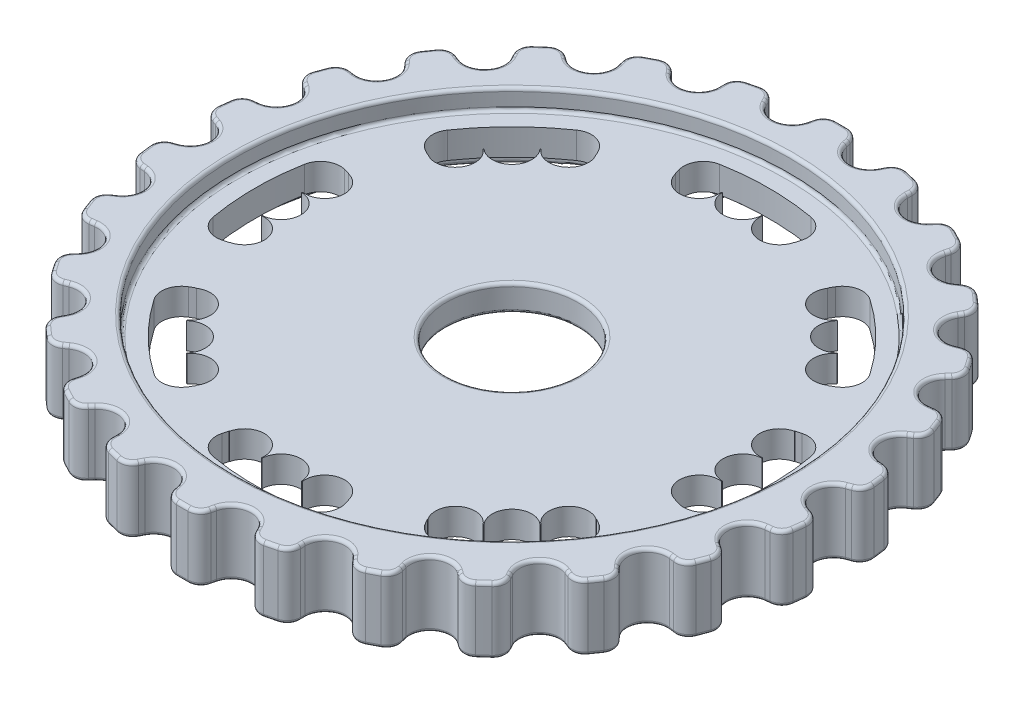
from build123d import *

# Parameters (mm, degrees)
SKETCH_1_W                          = 50
SKETCH_1_H                          = 10
CUT_REVOLVE_START                   = -5
CUT_REVOLVE_1_DEPTH                 = 10
SKETCH_5_W                          = 10
SKETCH_5_H                          = 10
FILLET_1_R                          = 2
FILLET_2_R                          = 3
PATTERN_CIRCULAR_1_COUNT            = 26
FILLET_1_OF_PATTERN_CIRCULAR_1_R    = 2
FILLET_2_OF_PATTERN_CIRCULAR_1_R    = 3
CUT_REVOLVE_7_DEPTH                 = 10
SKETCH_16_W                         = 3
SKETCH_16_H                         = 10
PATTERN_CIRCULAR_2_COUNT            = 2
PATTERN_CIRCULAR_2_ANGLE            = 10
PATTERN_CIRCULAR_3_COUNT            = 2
PATTERN_CIRCULAR_3_ANGLE            = 10
FILLET_3_R                          = 3
PATTERN_CIRCULAR_4_COUNT            = 8
PATTERN_CIRCULAR_4_COPY_1_SKETCH_W  = 3
PATTERN_CIRCULAR_4_COPY_1_SKETCH_H  = 10
PATTERN_CIRCULAR_4_COPY_2_SKETCH_W  = 3
PATTERN_CIRCULAR_4_COPY_2_SKETCH_H  = 10
PATTERN_CIRCULAR_4_COPY_3_SKETCH_W  = 3
PATTERN_CIRCULAR_4_COPY_3_SKETCH_H  = 10
PATTERN_CIRCULAR_4_COPY_4_SKETCH_W  = 3
PATTERN_CIRCULAR_4_COPY_4_SKETCH_H  = 10
PATTERN_CIRCULAR_4_COPY_5_SKETCH_W  = 3
PATTERN_CIRCULAR_4_COPY_5_SKETCH_H  = 10
PATTERN_CIRCULAR_4_COPY_6_SKETCH_W  = 3
PATTERN_CIRCULAR_4_COPY_6_SKETCH_H  = 10
PATTERN_CIRCULAR_4_COPY_7_SKETCH_W  = 3
PATTERN_CIRCULAR_4_COPY_7_SKETCH_H  = 10
PATTERN_CIRCULAR_4_COPY_8_SKETCH_W  = 3
PATTERN_CIRCULAR_4_COPY_8_SKETCH_H  = 10
PATTERN_CIRCULAR_4_COPY_9_SKETCH_W  = 3
PATTERN_CIRCULAR_4_COPY_9_SKETCH_H  = 10
PATTERN_CIRCULAR_4_COPY_10_SKETCH_W = 3
PATTERN_CIRCULAR_4_COPY_10_SKETCH_H = 10
PATTERN_CIRCULAR_4_COPY_11_SKETCH_W = 3
PATTERN_CIRCULAR_4_COPY_11_SKETCH_H = 10
PATTERN_CIRCULAR_4_COPY_12_SKETCH_W = 3
PATTERN_CIRCULAR_4_COPY_12_SKETCH_H = 10
PATTERN_CIRCULAR_4_COPY_13_SKETCH_W = 3
PATTERN_CIRCULAR_4_COPY_13_SKETCH_H = 10
PATTERN_CIRCULAR_4_COPY_14_SKETCH_W = 3
PATTERN_CIRCULAR_4_COPY_14_SKETCH_H = 10
FILLET_3_OF_PATTERN_CIRCULAR_4_R    = 3
FILLET_4_R                          = 0.5
SKETCH_17_W                         = 42
SKETCH_17_H                         = 4.5
FILLET_5_R                          = 0.5


# Read off the part's stored shape, not the designer's step: Вырез-Повернуть1, Вырез-Повернуть7
with BuildPart() as part:
    # Эскиз1 → Повернуть1 (revolve)
    with BuildSketch(Plane.XY, mode=Mode.PRIVATE) as revolve_1_sk:
        with Locations((25, 0)):
            Rectangle(SKETCH_1_W, SKETCH_1_H)
    revolve(revolve_1_sk.sketch.rotate(Axis((0, -5, 0), (0, 1, 0)), 90), axis=Axis((0, -5, 0), (0, 1, 0)))

    # Вырез-Повернуть1 outline → Вырез-Повернуть1 (cut)
    with BuildSketch(Plane(origin=(0, 0, 0), x_dir=(1, 0, 0), z_dir=(0, 1, 0)).offset(CUT_REVOLVE_START)):
        with BuildLine():
            Line((-49.870760692, -3.592663081), (-40, 0))
            Line((-40, 0), (-49.870760692, 3.592663081))
            ThreePointArc((-49.870760692, 3.592663081), (-50, 0), (-49.870760692, -3.592663081))
        make_face()
    cut_revolve_1 = extrude(amount=CUT_REVOLVE_1_DEPTH, mode=Mode.SUBTRACT)

    # Эскиз5 → Вырез-Повернуть2 (revolve, cut)
    with BuildSketch(Plane(origin=(0, 0, 0), x_dir=(0, 0, -1), z_dir=(1, 0, 0)), mode=Mode.PRIVATE) as cut_revolve_2_sk:
        with Locations((-5, 0)):
            Rectangle(SKETCH_5_W, SKETCH_5_H)
    revolve(cut_revolve_2_sk.sketch.rotate(Axis((0, -5, 0), (0, 1, 0)), 180), axis=Axis((0, -5, 0), (0, 1, 0)), mode=Mode.SUBTRACT)

    # Скругление1
    fillet_1_edges = [part.edges().sort_by_distance(p)[0] for p in [
        (-49.870760692, 0, -3.592663081),
        (-49.870760692, 0, 3.592663081),
    ]]
    fillet(fillet_1_edges, radius=FILLET_1_R)

    # Скругление2
    fillet_2_edges = [part.edges().sort_by_distance(p)[0] for p in [
        (-40, 0, 0),
    ]]
    fillet(fillet_2_edges, radius=FILLET_2_R)

    # Круговой массив1: Вырез-Повернуть1 ×26 about axis
    pattern_circular_1_axis = Axis((0, 0, 0), (0, 1, 0))
    for i in range(1, PATTERN_CIRCULAR_1_COUNT):
        add(cut_revolve_1.rotate(pattern_circular_1_axis, i * 360 / PATTERN_CIRCULAR_1_COUNT), mode=Mode.SUBTRACT)

    # Скругление1 of Круговой массив1
    fillet_1_of_pattern_circular_1_edges = [part.edges().sort_by_distance(p)[0] for p in [
        (-49.281387575, 0, 8.446587402),
        (-47.561826471, 0, 15.423121045),
        (-45.827959342, 0, 19.994952928),
        (-42.488771776, 0, 26.357243274),
        (-39.71117669, 0, 30.381284468),
        (-34.946424105, 0, 35.759578329),
        (-31.286524793, 0, 39.001966186),
        (-25.373117291, 0, 43.083696673),
        (-21.043613797, 0, 45.355995396),
        (-14.325217127, 0, 47.903947168),
        (-9.577724458, 0, 49.074099016),
        (-2.444787413, 0, 49.940194378),
        (2.444787413, 0, 49.940194378),
        (9.577724458, 0, 49.074099016),
        (14.325217127, 0, 47.903947168),
        (21.043613797, 0, 45.355995396),
        (25.373117291, 0, 43.083696673),
        (31.286524793, 0, 39.001966186),
        (34.946424105, 0, 35.759578329),
        (39.71117669, 0, 30.381284468),
        (42.488771776, 0, 26.357243274),
        (45.827959342, 0, 19.994952928),
        (47.561826471, 0, 15.423121045),
        (49.281387575, 0, 8.446587402),
        (49.870760692, 0, 3.592663081),
        (49.870760692, 0, -3.592663081),
        (49.281387575, 0, -8.446587402),
        (47.561826471, 0, -15.423121045),
        (45.827959342, 0, -19.994952928),
        (42.488771776, 0, -26.357243274),
        (39.71117669, 0, -30.381284468),
        (34.946424105, 0, -35.759578329),
        (31.286524793, 0, -39.001966186),
        (25.373117291, 0, -43.083696673),
        (21.043613797, 0, -45.355995396),
        (14.325217127, 0, -47.903947168),
        (9.577724458, 0, -49.074099016),
        (2.444787413, 0, -49.940194378),
        (-2.444787413, 0, -49.940194378),
        (-9.577724458, 0, -49.074099016),
        (-14.325217127, 0, -47.903947168),
        (-21.043613797, 0, -45.355995396),
        (-25.373117291, 0, -43.083696673),
        (-31.286524793, 0, -39.001966186),
        (-34.946424105, 0, -35.759578329),
        (-39.71117669, 0, -30.381284468),
        (-42.488771776, 0, -26.357243274),
        (-45.827959342, 0, -19.994952928),
        (-47.561826471, 0, -15.423121045),
        (-49.281387575, 0, -8.446587402),
    ]]
    fillet(fillet_1_of_pattern_circular_1_edges, radius=FILLET_1_OF_PATTERN_CIRCULAR_1_R)

    # Скругление2 of Круговой массив1
    fillet_2_of_pattern_circular_1_edges = [part.edges().sort_by_distance(p)[0] for p in [
        (-38.837672697, 0, 9.572626572),
        (-35.418241026, 0, 18.588926882),
        (-29.940429927, 0, 26.52490633),
        (-22.722589869, 0, 32.919354636),
        (-14.184195482, 0, 37.400649707),
        (-4.82146721, 0, 39.708354964),
        (4.82146721, 0, 39.708354964),
        (14.184195482, 0, 37.400649707),
        (22.722589869, 0, 32.919354636),
        (29.940429927, 0, 26.52490633),
        (35.418241026, 0, 18.588926882),
        (38.837672697, 0, 9.572626572),
        (40, 0, 0),
        (38.837672697, 0, -9.572626572),
        (35.418241026, 0, -18.588926882),
        (29.940429927, 0, -26.52490633),
        (22.722589869, 0, -32.919354636),
        (14.184195482, 0, -37.400649707),
        (4.82146721, 0, -39.708354964),
        (-4.82146721, 0, -39.708354964),
        (-14.184195482, 0, -37.400649707),
        (-22.722589869, 0, -32.919354636),
        (-29.940429927, 0, -26.52490633),
        (-35.418241026, 0, -18.588926882),
        (-38.837672697, 0, -9.572626572),
    ]]
    fillet(fillet_2_of_pattern_circular_1_edges, radius=FILLET_2_OF_PATTERN_CIRCULAR_1_R)

    # Вырез-Повернуть7 outline → Вырез-Повернуть7 (cut)
    with BuildSketch(Plane(origin=(0, 0, 0), x_dir=(1, 0, 0), z_dir=(0, 1, 0)).offset(CUT_REVOLVE_START)):
        with BuildLine():
            Line((-33.80740392, 9.058666579), (-37.671107225, 10.093942759))
            ThreePointArc((-37.671107225, 10.093942759), (-39, 0), (-37.671107225, -10.093942759))
            Line((-37.671107225, -10.093942759), (-33.80740392, -9.058666579))
            ThreePointArc((-33.80740392, -9.058666579), (-35, 0), (-33.80740392, 9.058666579))
        make_face()
    cut_revolve_7 = extrude(amount=CUT_REVOLVE_7_DEPTH, mode=Mode.SUBTRACT)

    # Эскиз16 → Вырез-Повернуть8 (revolve, cut)
    with BuildSketch(Plane.XY):
        with Locations((-33.5, 0)):
            Rectangle(SKETCH_16_W, SKETCH_16_H)
    cut_revolve_8 = revolve(axis=Axis((-35, 5, 0), (0, -1, 0)), mode=Mode.SUBTRACT)

    # Круговой массив2: Вырез-Повернуть8 ×2 about axis
    pattern_circular_2_axis = Axis((0, 5, 0), (0, 1, 0))
    for i in range(1, PATTERN_CIRCULAR_2_COUNT):
        add(cut_revolve_8.rotate(pattern_circular_2_axis, i * PATTERN_CIRCULAR_2_ANGLE / (PATTERN_CIRCULAR_2_COUNT - 1)), mode=Mode.SUBTRACT)

    # Круговой массив3: Вырез-Повернуть8 ×2 about axis
    pattern_circular_3_axis = Axis((0, 5, 0), (0, -1, 0))
    for i in range(1, PATTERN_CIRCULAR_3_COUNT):
        add(cut_revolve_8.rotate(pattern_circular_3_axis, i * PATTERN_CIRCULAR_3_ANGLE / (PATTERN_CIRCULAR_3_COUNT - 1)), mode=Mode.SUBTRACT)

    # Скругление3
    fillet_3_edges = [part.edges().sort_by_distance(p)[0] for p in [
        (-37.671107225, 0, -10.093942759),
        (-37.671107225, 0, 10.093942759),
    ]]
    fillet(fillet_3_edges, radius=FILLET_3_R)

    # Круговой массив4: Вырез-Повернуть7, Вырез-Повернуть8 ×8 about axis
    pattern_circular_4_axis = Axis((0, 0, 0), (0, 1, 0))
    add([cut_revolve_7.rotate(pattern_circular_4_axis, i * 360 / PATTERN_CIRCULAR_4_COUNT) for i in range(1, PATTERN_CIRCULAR_4_COUNT)], mode=Mode.SUBTRACT)
    add([cut_revolve_8.rotate(pattern_circular_4_axis, i * 360 / PATTERN_CIRCULAR_4_COUNT) for i in range(1, PATTERN_CIRCULAR_4_COUNT)], mode=Mode.SUBTRACT)

    # Круговой массив4 copy 1 sketch → Круговой массив4 copy 1 (revolve, cut)
    with BuildSketch(Plane(origin=(0, 0, 0), x_dir=(0.5735764363510458, 0, -0.819152044288992), z_dir=(0.819152044288992, 0, 0.5735764363510458))):
        with Locations((-33.5, 0)):
            Rectangle(PATTERN_CIRCULAR_4_COPY_1_SKETCH_W, PATTERN_CIRCULAR_4_COPY_1_SKETCH_H)
    revolve(axis=Axis((-20.075175272, 5, 28.67032155), (0, -1, 0)), mode=Mode.SUBTRACT)

    # Круговой массив4 copy 2 sketch → Круговой массив4 copy 2 (revolve, cut)
    with BuildSketch(Plane(origin=(0, 0, 0), x_dir=(-0.17364817766693066, 0, -0.984807753012208), z_dir=(0.984807753012208, 0, -0.17364817766693066))):
        with Locations((-33.5, 0)):
            Rectangle(PATTERN_CIRCULAR_4_COPY_2_SKETCH_W, PATTERN_CIRCULAR_4_COPY_2_SKETCH_H)
    revolve(axis=Axis((6.077686218, 5, 34.468271355), (0, -1, 0)), mode=Mode.SUBTRACT)

    # Круговой массив4 copy 3 sketch → Круговой массив4 copy 3 (revolve, cut)
    with BuildSketch(Plane(origin=(0, 0, 0), x_dir=(-0.819152044288992, 0, -0.5735764363510458), z_dir=(0.5735764363510458, 0, -0.819152044288992))):
        with Locations((-33.5, 0)):
            Rectangle(PATTERN_CIRCULAR_4_COPY_3_SKETCH_W, PATTERN_CIRCULAR_4_COPY_3_SKETCH_H)
    revolve(axis=Axis((28.67032155, 5, 20.075175272), (0, -1, 0)), mode=Mode.SUBTRACT)

    # Круговой массив4 copy 4 sketch → Круговой массив4 copy 4 (revolve, cut)
    with BuildSketch(Plane(origin=(0, 0, 0), x_dir=(-0.984807753012208, 0, 0.1736481776669306), z_dir=(-0.1736481776669306, 0, -0.984807753012208))):
        with Locations((-33.5, 0)):
            Rectangle(PATTERN_CIRCULAR_4_COPY_4_SKETCH_W, PATTERN_CIRCULAR_4_COPY_4_SKETCH_H)
    revolve(axis=Axis((34.468271355, 5, -6.077686218), (0, -1, 0)), mode=Mode.SUBTRACT)

    # Круговой массив4 copy 5 sketch → Круговой массив4 copy 5 (revolve, cut)
    with BuildSketch(Plane(origin=(0, 0, 0), x_dir=(-0.573576436351046, 0, 0.819152044288992), z_dir=(-0.819152044288992, 0, -0.573576436351046))):
        with Locations((-33.5, 0)):
            Rectangle(PATTERN_CIRCULAR_4_COPY_5_SKETCH_W, PATTERN_CIRCULAR_4_COPY_5_SKETCH_H)
    revolve(axis=Axis((20.075175272, 5, -28.67032155), (0, -1, 0)), mode=Mode.SUBTRACT)

    # Круговой массив4 copy 6 sketch → Круговой массив4 copy 6 (revolve, cut)
    with BuildSketch(Plane(origin=(0, 0, 0), x_dir=(0.17364817766693053, 0, 0.984807753012208), z_dir=(-0.984807753012208, 0, 0.17364817766693053))):
        with Locations((-33.5, 0)):
            Rectangle(PATTERN_CIRCULAR_4_COPY_6_SKETCH_W, PATTERN_CIRCULAR_4_COPY_6_SKETCH_H)
    revolve(axis=Axis((-6.077686218, 5, -34.468271355), (0, -1, 0)), mode=Mode.SUBTRACT)

    # Круговой массив4 copy 7 sketch → Круговой массив4 copy 7 (revolve, cut)
    with BuildSketch(Plane(origin=(0, 0, 0), x_dir=(0.8191520442889919, 0, 0.573576436351046), z_dir=(-0.573576436351046, 0, 0.8191520442889919))):
        with Locations((-33.5, 0)):
            Rectangle(PATTERN_CIRCULAR_4_COPY_7_SKETCH_W, PATTERN_CIRCULAR_4_COPY_7_SKETCH_H)
    revolve(axis=Axis((-28.67032155, 5, -20.075175272), (0, -1, 0)), mode=Mode.SUBTRACT)

    # Круговой массив4 copy 8 sketch → Круговой массив4 copy 8 (revolve, cut)
    with BuildSketch(Plane(origin=(0, 0, 0), x_dir=(0.8191520442889921, 0, -0.5735764363510457), z_dir=(0.5735764363510457, 0, 0.8191520442889921))):
        with Locations((-33.5, 0)):
            Rectangle(PATTERN_CIRCULAR_4_COPY_8_SKETCH_W, PATTERN_CIRCULAR_4_COPY_8_SKETCH_H)
    revolve(axis=Axis((-28.67032155, 5, 20.075175272), (0, -1, 0)), mode=Mode.SUBTRACT)

    # Круговой массив4 copy 9 sketch → Круговой массив4 copy 9 (revolve, cut)
    with BuildSketch(Plane(origin=(0, 0, 0), x_dir=(0.1736481776669308, 0, -0.984807753012208), z_dir=(0.984807753012208, 0, 0.1736481776669308))):
        with Locations((-33.5, 0)):
            Rectangle(PATTERN_CIRCULAR_4_COPY_9_SKETCH_W, PATTERN_CIRCULAR_4_COPY_9_SKETCH_H)
    revolve(axis=Axis((-6.077686218, 5, 34.468271355), (0, -1, 0)), mode=Mode.SUBTRACT)

    # Круговой массив4 copy 10 sketch → Круговой массив4 copy 10 (revolve, cut)
    with BuildSketch(Plane(origin=(0, 0, 0), x_dir=(-0.5735764363510457, 0, -0.8191520442889921), z_dir=(0.8191520442889921, 0, -0.5735764363510457))):
        with Locations((-33.5, 0)):
            Rectangle(PATTERN_CIRCULAR_4_COPY_10_SKETCH_W, PATTERN_CIRCULAR_4_COPY_10_SKETCH_H)
    revolve(axis=Axis((20.075175272, 5, 28.67032155), (0, -1, 0)), mode=Mode.SUBTRACT)

    # Круговой массив4 copy 11 sketch → Круговой массив4 copy 11 (revolve, cut)
    with BuildSketch(Plane(origin=(0, 0, 0), x_dir=(-0.984807753012208, 0, -0.17364817766693086), z_dir=(0.17364817766693086, 0, -0.984807753012208))):
        with Locations((-33.5, 0)):
            Rectangle(PATTERN_CIRCULAR_4_COPY_11_SKETCH_W, PATTERN_CIRCULAR_4_COPY_11_SKETCH_H)
    revolve(axis=Axis((34.468271355, 5, 6.077686218), (0, -1, 0)), mode=Mode.SUBTRACT)

    # Круговой массив4 copy 12 sketch → Круговой массив4 copy 12 (revolve, cut)
    with BuildSketch(Plane(origin=(0, 0, 0), x_dir=(-0.8191520442889922, 0, 0.5735764363510457), z_dir=(-0.5735764363510457, 0, -0.8191520442889922))):
        with Locations((-33.5, 0)):
            Rectangle(PATTERN_CIRCULAR_4_COPY_12_SKETCH_W, PATTERN_CIRCULAR_4_COPY_12_SKETCH_H)
    revolve(axis=Axis((28.67032155, 5, -20.075175272), (0, -1, 0)), mode=Mode.SUBTRACT)

    # Круговой массив4 copy 13 sketch → Круговой массив4 copy 13 (revolve, cut)
    with BuildSketch(Plane(origin=(0, 0, 0), x_dir=(-0.17364817766693094, 0, 0.984807753012208), z_dir=(-0.984807753012208, 0, -0.17364817766693094))):
        with Locations((-33.5, 0)):
            Rectangle(PATTERN_CIRCULAR_4_COPY_13_SKETCH_W, PATTERN_CIRCULAR_4_COPY_13_SKETCH_H)
    revolve(axis=Axis((6.077686218, 5, -34.468271355), (0, -1, 0)), mode=Mode.SUBTRACT)

    # Круговой массив4 copy 14 sketch → Круговой массив4 copy 14 (revolve, cut)
    with BuildSketch(Plane(origin=(0, 0, 0), x_dir=(0.5735764363510456, 0, 0.8191520442889921), z_dir=(-0.8191520442889921, 0, 0.5735764363510456))):
        with Locations((-33.5, 0)):
            Rectangle(PATTERN_CIRCULAR_4_COPY_14_SKETCH_W, PATTERN_CIRCULAR_4_COPY_14_SKETCH_H)
    revolve(axis=Axis((-20.075175272, 5, -28.67032155), (0, -1, 0)), mode=Mode.SUBTRACT)

    # Скругление3 of Круговой массив4
    fillet_3_of_pattern_circular_4_edges = [part.edges().sort_by_distance(p)[0] for p in [
        (-33.774990747, 0, 19.5),
        (-19.5, 0, 33.774990747),
        (-10.093942759, 0, 37.671107225),
        (10.093942759, 0, 37.671107225),
        (19.5, 0, 33.774990747),
        (33.774990747, 0, 19.5),
        (37.671107225, 0, 10.093942759),
        (37.671107225, 0, -10.093942759),
        (33.774990747, 0, -19.5),
        (19.5, 0, -33.774990747),
        (10.093942759, 0, -37.671107225),
        (-10.093942759, 0, -37.671107225),
        (-19.5, 0, -33.774990747),
        (-33.774990747, 0, -19.5),
    ]]
    fillet(fillet_3_of_pattern_circular_4_edges, radius=FILLET_3_OF_PATTERN_CIRCULAR_4_R)

    # Скругление4
    fillet_4_edges = [part.edges().sort_by_distance(p)[0] for p in [
        (2.101636024, -5, 49.547635291),
        (16.230766808, -5, 42.797014794),
        (19.803960719, -5, 43.918283287),
        (31.283062471, -5, 38.480580029),
        (46.750812134, -5, 17.730244352),
        (48.086889478, -5, 2.943387057),
        (49.635443705, -5, -6.026834013),
        (44.44137912, -5, -10.953816156),
        (34.26039474, -5, -30.352061194),
        (24.894106633, -5, -41.246768624),
        (-5.517134198, -5, -45.437688065),
        (-13.898091554, -5, -47.604916637),
        (-21.165027958, -5, -44.848931185),
        (-43.946686213, -5, -19.740852006),
        (-39.583039102, -5, 29.875877433),
        (-34.26039474, -5, 30.352061194),
        (-34.429256777, -5, 35.693295095),
        (-9.816958953, -5, 48.61082548),
        (-9.816958953, 5, 48.61082548),
        (-34.429256777, 5, 35.693295095),
        (-39.583039102, 5, 29.875877433),
        (-45.582593379, 5, -19.534897434),
        (-41.149193295, 5, -28.403237337),
        (-34.26039474, 5, -30.352061194),
        (-29.738826751, 5, -37.902699778),
        (-16.230766808, 5, -42.797014794),
        (39.583039102, 5, -29.875877433),
        (41.149193295, 5, -28.403237337),
        (40.528573622, 5, -21.271036332),
        (47.073094189, 5, -15.604769797),
        (48.933053015, 5, -8.058620204),
        (46.750812134, 5, 17.730244352),
        (45.582593379, 5, 19.534897434),
        (34.04172697, 5, 34.090662825),
        (21.165027958, 5, 44.848931185),
        (13.898091554, 5, 47.604916637),
        (11.965783214, 5, 48.547090871),
        (2.101636024, 5, 49.547635291),
    ]]
    fillet(fillet_4_edges, radius=FILLET_4_R)

    # Эскиз17 → Вырез-Повернуть9 (revolve, cut)
    with BuildSketch(Plane.XY, mode=Mode.PRIVATE) as cut_revolve_9_sk:
        with Locations((-21, 4.25)):
            Rectangle(SKETCH_17_W, SKETCH_17_H)
    cut_revolve_9 = revolve(cut_revolve_9_sk.sketch.rotate(Axis((0, 6.5, 0), (0, -1, 0)), 90), axis=Axis((0, 6.5, 0), (0, -1, 0)), mode=Mode.SUBTRACT)

    # Зеркальное отражение1: Вырез-Повернуть9 across plane
    add(cut_revolve_9.mirror(Plane.ZX), mode=Mode.SUBTRACT)

    # Скругление5
    fillet_5_edges = [part.edges().sort_by_distance(p)[0] for p in [
        (0, 5, 42),
        (0, 2, 10),
        (0, 2, 42),
        (0, -5, 42),
        (0, -2, 10),
        (0, -2, 42),
    ]]
    fillet(fillet_5_edges, radius=FILLET_5_R)


solid = part.part
